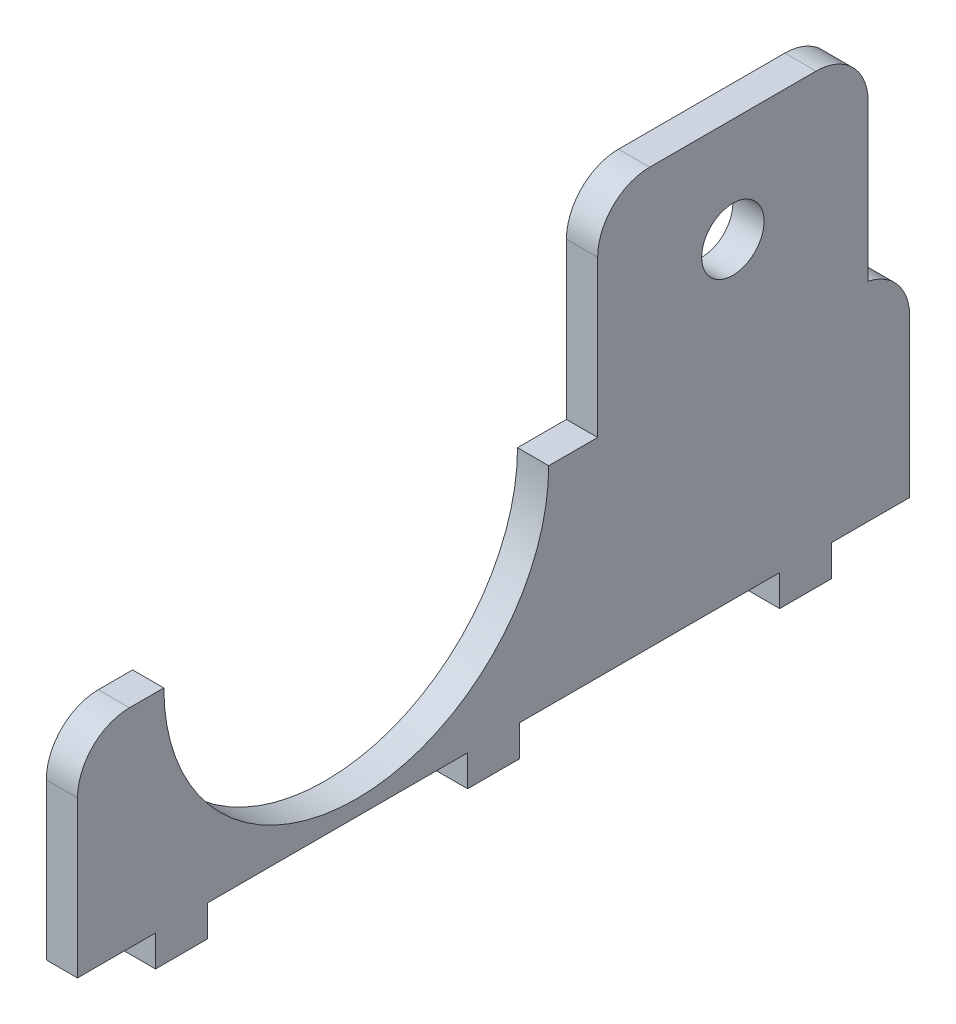
from build123d import *

# Parameters (mm, degrees)
SKETCH1_W           = 80
SKETCH1_H           = 40
BOSS_EXTRUDE1_DEPTH = 3
SKETCH8_R           = 3
SKETCH8_W           = 4
SKETCH8_H           = 20
CUT_EXTRUDE4_DEPTH  = 54.761045377
FILLET1_R           = 5
SKETCH3_W           = 3
SKETCH3_H           = 5
BOSS_EXTRUDE2_DEPTH = 3
LPATTERN1_COUNT     = 3
LPATTERN1_PITCH     = 30


with BuildPart() as part:
    # Sketch1 → Boss-Extrude1 (new body)
    with BuildSketch(Plane(origin=(0, 0, 0), x_dir=(0, 0, -1), z_dir=(1, 0, 0))):
        with Locations((-7.5, -5)):
            Rectangle(SKETCH1_W, SKETCH1_H)
    extrude(amount=BOSS_EXTRUDE1_DEPTH)

    # Sketch8 → Cut-Extrude4 (cut, through all)
    with BuildSketch(Plane.ZY):
        with Locations((-15.5, 5)):
            Circle(SKETCH8_R)
        with BuildLine():
            Line((39.2, -5), (47.5, -5))
            Line((47.5, -5), (47.5, 15))
            Line((47.5, 15), (39.2, 15))
            Line((39.2, 15), (2.2, 15))
            Line((2.2, 15), (-2.5, 15))
            Line((-2.5, 15), (-2.5, -5))
            Line((-2.5, -5), (2.2, -5))
            ThreePointArc((2.2, -5), (20.7, -23.5), (39.2, -5))
        make_face()
        with Locations((-30.5, 5)):
            Rectangle(SKETCH8_W, SKETCH8_H)
    extrude(amount=-CUT_EXTRUDE4_DEPTH, mode=Mode.SUBTRACT)

    # Fillet1
    # the kernel refuses this fillet: 5 mm, written as the material it takes off along each edge
    with BuildSketch(Plane(origin=(-12.5, -5, 47.5), x_dir=(0, -1, 0), z_dir=(1, 0, 0)), Plane(origin=(-12.5, 15, -28.5), x_dir=(0, 0, 1), z_dir=(1, 0, 0))) as fillet1_piece_1:
        with BuildLine():
            CenterArc((FILLET1_R, FILLET1_R), FILLET1_R, 180, 90)
            Line((0, FILLET1_R), (-FILLET1_R * 0.02, FILLET1_R))
            Line((-FILLET1_R * 0.02, FILLET1_R), (-FILLET1_R * 0.02, -FILLET1_R * 0.02))
            Line((-FILLET1_R * 0.02, -FILLET1_R * 0.02), (FILLET1_R, -FILLET1_R * 0.02))
            Line((FILLET1_R, -FILLET1_R * 0.02), (FILLET1_R, 0))
        make_face()
    extrude(amount=28, mode=Mode.SUBTRACT)
    with BuildSketch(Plane(origin=(-12.5, 15, -2.5), x_dir=(0, 0, -1), z_dir=(1, 0, 0))) as fillet1_piece_2:
        with BuildLine():
            CenterArc((FILLET1_R, -FILLET1_R), FILLET1_R, 90, 90)
            Line((0, -FILLET1_R), (-FILLET1_R * 0.02, -FILLET1_R))
            Line((-FILLET1_R * 0.02, -FILLET1_R), (-FILLET1_R * 0.02, FILLET1_R * 0.02))
            Line((-FILLET1_R * 0.02, FILLET1_R * 0.02), (FILLET1_R, FILLET1_R * 0.02))
            Line((FILLET1_R, FILLET1_R * 0.02), (FILLET1_R, 0))
        make_face()
    extrude(amount=28, mode=Mode.SUBTRACT)
    with BuildSketch(Plane(origin=(-12.247448714, -5, -32.5), x_dir=(0, -1.5645262863012704e-12, 1.0), z_dir=(1, 0, 0))) as fillet1_piece_3:
        with BuildLine():
            CenterArc((5, 4.898979486), FILLET1_R, 180, 78.463040967)
            Line((0, 4.898979486), (-0.1, 4.898979486))
            Line((-0.1, 4.898979486), (-0.1, 0))
            Line((-0.1, 0), (0, -0.1))
            ThreePointArc((0, -0.1), (2, -0.1), (3.98, -0.09797959))
            Line((3.98, -0.09797959), (4, 0))
        make_face()
    extrude(amount=27.494897428, mode=Mode.SUBTRACT)

    # Sketch3 → Boss-Extrude2 (add)
    with BuildSketch(Plane.XZ.offset(25)):
        with Locations((1.5, 37.5)):
            Rectangle(SKETCH3_W, SKETCH3_H)
    boss_extrude2 = extrude(amount=BOSS_EXTRUDE2_DEPTH)

    # LPattern1: Boss-Extrude2 ×3
    with Locations(*[(0, 0, -i * LPATTERN1_PITCH) for i in range(1, LPATTERN1_COUNT)]):
        add(boss_extrude2)


solid = part.part
